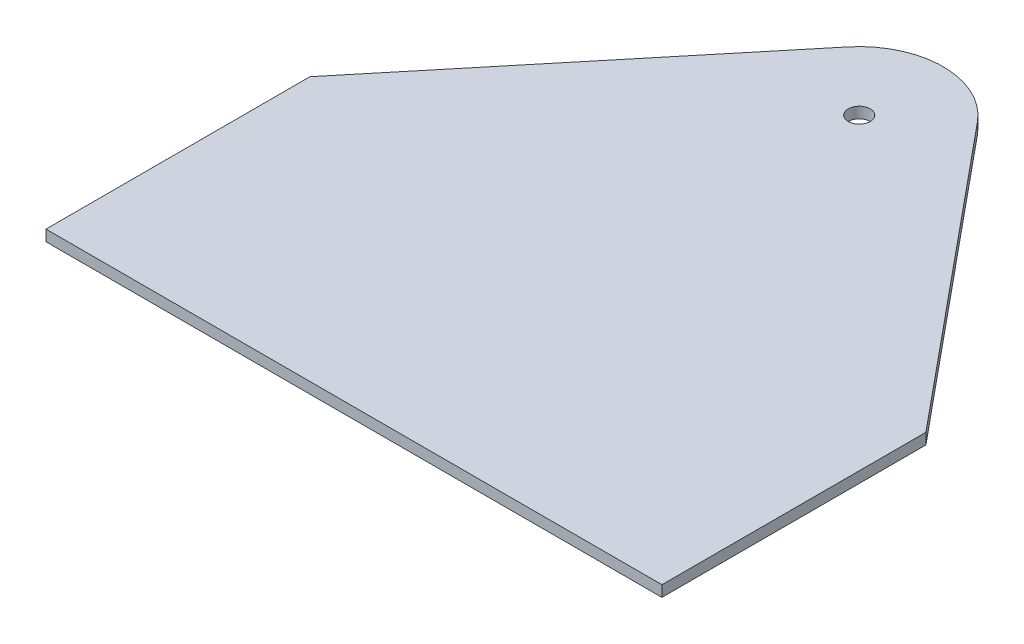
from build123d import *

# Parameters (mm, degrees)
SKETCH1_R           = 3.175
BOSS_EXTRUDE1_DEPTH = 3.175


with BuildPart() as part:
    # Sketch1 → Boss-Extrude1 (new body)
    with BuildSketch(Plane(origin=(0, 0, 0), x_dir=(1, 0, 0), z_dir=(0, 1, 0))):
        with BuildLine():
            Line((-88.9, 0), (88.9, 0))
            Line((88.9, 0), (88.9, 76.2))
            Line((88.9, 76.2), (18.702682169, 161.291999073))
            ThreePointArc((18.702682169, 161.291999073), (0, 170.108527998), (-18.702682169, 161.291999073))
            Line((-18.702682169, 161.291999073), (-88.9, 76.2))
            Line((-88.9, 76.2), (-88.9, 0))
        make_face()
        with Locations((0, 145.863073453)):
            Circle(SKETCH1_R, mode=Mode.SUBTRACT)
    extrude(amount=BOSS_EXTRUDE1_DEPTH)


solid = part.part
